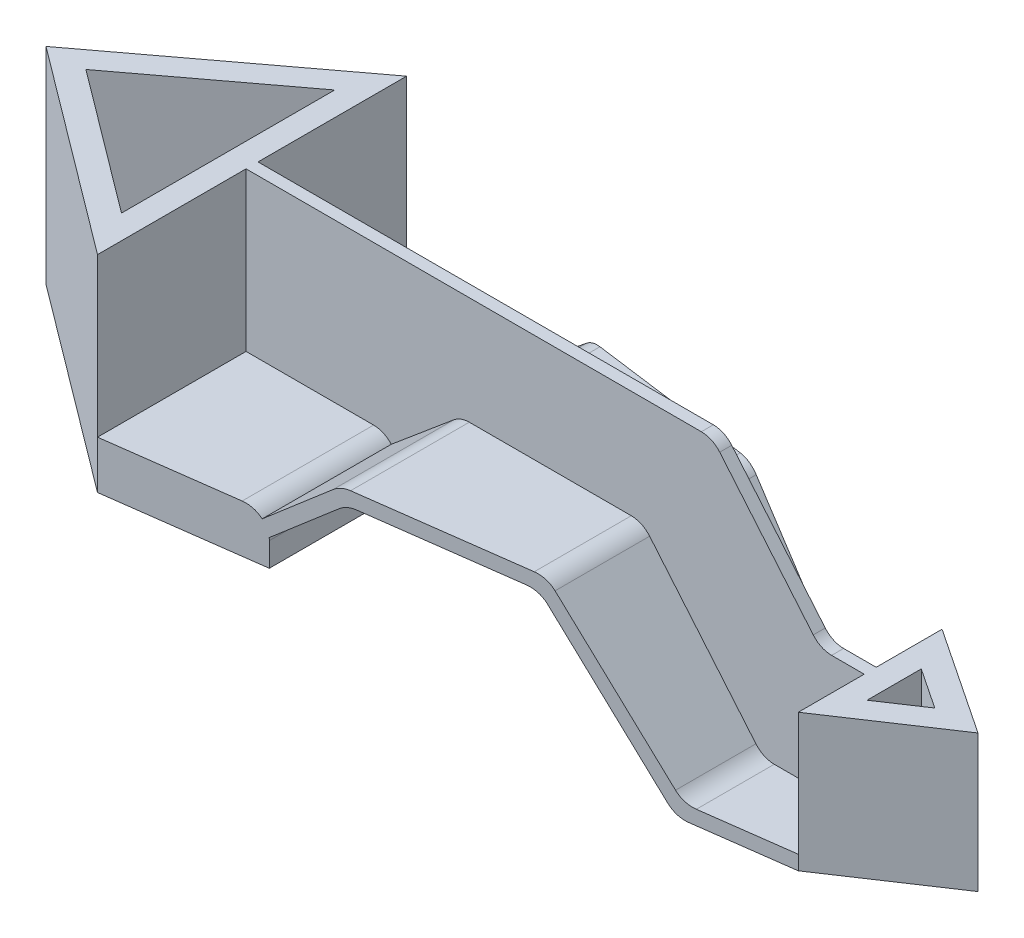
from build123d import *

# Parameters (mm, degrees)
EXTRUDE_1_DEPTH             = 86
EXTRUDE_1_2_DEPTH           = 64.5
EXTRUDE_1_2_DEPTH_BACK      = 64.5
EXTRUDE_5_DEPTH             = 57.333333333
CUT_EXTRUDE_5_DEPTH         = 328.099755426
CUT_EXTRUDE_5_DEPTH_BACK    = 328.099755426
SKETCH_13_OUTSIDE_W         = 475.92
SKETCH_13_OUTSIDE_H         = 215.92
RIB_START                   = -2.5
RIB_2_DEPTH                 = 5
FILLET_1_R                  = 10
CUT_EXTRUDE_3_DEPTH         = 322.504665596
CUT_EXTRUDE_3_DEPTH_BACK    = 322.504665596
SKETCH_10_R                 = 5
CUT_EXTRUDE_4_DEPTH         = 322.504665596
CUT_EXTRUDE_4_DEPTH_BACK    = 322.504665596
SKETCH_11_R                 = 5
EXTRUDE_6_REACH             = 323.505
EXTRUDE_6_DIRECTION_2_REACH = 323.505


# Read off the part's stored shape, not the designer's step: 보강대2
with BuildPart() as part:
    # 스케치1 → Extrude 1 (new body)
    with BuildSketch(Plane(origin=(0, 0, 0), x_dir=(1, 0, 0), z_dir=(0, 1, 0))):
        Polygon((0, 64.5), (0, -64.5), (-86, 0), align=None)
        Polygon((-10, 44.5), (-69.333333333, 0), (-10, -44.5), align=None, mode=Mode.SUBTRACT)
    extrude(amount=EXTRUDE_1_DEPTH)


with BuildPart() as body_2:
    # 스케치3 → Extrude 1 2 (new, two sides: drawn at the far end of the back side and taken through both)
    with BuildSketch(Plane.XY.offset(-EXTRUDE_1_2_DEPTH_BACK)):
        Polygon((0, 0), (50, 0), (91.711375741, 35), (162.654022129, 35), (213, -25), (258, -25), (258, -19), (215.797845949, -19), (165.451868078, 41), (89.527554335, 41), (47.816178594, 6), (0, 6), align=None)
    extrude(amount=EXTRUDE_1_2_DEPTH + EXTRUDE_1_2_DEPTH_BACK)

    # 스케치13 outside → 컷-돌출5 (cut, two sides: drawn at the far end of the back side and taken through both)
    with BuildSketch(Plane(origin=(0, -19, 0), x_dir=(1, 0, 0), z_dir=(0, 1, 0)).offset(-CUT_EXTRUDE_5_DEPTH_BACK)):
        with Locations((108.5, 0)):
            Rectangle(SKETCH_13_OUTSIDE_W, SKETCH_13_OUTSIDE_H)
        Polygon((0, 64.5), (258, 30), (258, -30), (0, -64.5), align=None, mode=Mode.SUBTRACT)
    extrude(amount=CUT_EXTRUDE_5_DEPTH + CUT_EXTRUDE_5_DEPTH_BACK, mode=Mode.SUBTRACT)


with BuildPart() as body_3:
    # 스케치12 → 보스-돌출5 (new body)
    with BuildSketch(Plane.XZ.offset(25)):
        Polygon((258, 30), (258, -30), (303, 0), align=None)
        Polygon((268, 11.314829082), (284.972243623, 0), (268, -11.314829082), align=None, mode=Mode.SUBTRACT)
    extrude(amount=-EXTRUDE_5_DEPTH)


with BuildPart() as part_1:
    add(part.part)

    # Combine 1: union body 3, body 2
    add(body_3.part)
    add(body_2.part)

    # 보강대2 outline → 보강대2 (add)
    with BuildSketch(Plane.XY.offset(RIB_START)):
        Polygon((239.734972401, 32.333333333), (194.703292194, 86), (0, 86), (0, 6), (47.816178594, 6), (89.527554335, 41), (165.451868078, 41), (215.797845949, -19), (258, -19), (258, 32.333333333), align=None)
    extrude(amount=RIB_2_DEPTH)

    # 필렛1
    fillet_1_edges = [part_1.edges().sort_by_distance(p)[0] for p in [
        (194.703292194, 86, 0),
        (213, -25, 0),
        (215.797845949, -19, 19.071655649),
        (165.451868078, 41, 22.437811146),
        (89.527554335, 41, 27.514146076),
        (47.816178594, 6, 30.302988059),
        (50, 0, 0),
        (91.711375741, 35, 0),
        (162.654022129, 35, 0),
        (47.816178594, 6, -30.302988059),
        (89.527554335, 41, -27.514146076),
        (165.451868078, 41, -22.437811146),
        (215.797845949, -19, -19.071655649),
        (239.734972401, 32.333333333, 0),
    ]]
    fillet(fillet_1_edges, radius=FILLET_1_R)

    # 스케치10 → 컷-돌출3 (cut, two sides: drawn at the far end of the back side and taken through both)
    with BuildSketch(Plane.XY.offset(-CUT_EXTRUDE_3_DEPTH_BACK)):
        with Locations((158, -20)):
            Circle(SKETCH_10_R)
    extrude(amount=CUT_EXTRUDE_3_DEPTH + CUT_EXTRUDE_3_DEPTH_BACK, mode=Mode.SUBTRACT)

    # 스케치11 → 컷-돌출4 (cut, two sides: drawn at the far end of the back side and taken through both)
    with BuildSketch(Plane.XY.offset(-CUT_EXTRUDE_4_DEPTH_BACK)):
        with Locations(Location((53.25, 10, 0), (0, 0, 44.917604926))):
            Circle(SKETCH_11_R)
    extrude(amount=CUT_EXTRUDE_4_DEPTH + CUT_EXTRUDE_4_DEPTH_BACK, mode=Mode.SUBTRACT)

    # 보스-돌출6: up to this plane
    extrude_6_end = Plane(origin=(258, -25, 30), z_dir=(0.13254117731278448, 0, 0.9911774999043013))
    # 스케치8 → 보스-돌출6 (add, up to the surface)
    with BuildSketch(Plane.XY, mode=Mode.PRIVATE) as extrude_6_sk1:
        with BuildLine():
            Line((63.25, 0), (0, 0))
            Line((0, 0), (0, 20))
            Line((0, 20), (53.25, 20))
            ThreePointArc((53.25, 20), (60.321067812, 17.071067812), (63.25, 10))
            Line((63.25, 10), (63.25, 0))
        make_face()
    extrude_6_tool1 = split(extrude(extrude_6_sk1.sketch, amount=EXTRUDE_6_REACH, mode=Mode.PRIVATE), bisect_by=extrude_6_end, keep=Keep.BOTH, mode=Mode.PRIVATE)
    add(extrude_6_tool1.solids().sort_by_distance((31.117784, 9.865974, 0))[0])

    # 보스-돌출6 direction 2: up to this plane
    extrude_6_direction_2_end = Plane(origin=(0, -25, -64.5), z_dir=(0.13254117731278448, 0, -0.9911774999043013))
    # 스케치8 → 보스-돌출6 direction 2 (add, up to the surface)
    with BuildSketch(Plane.XY, mode=Mode.PRIVATE) as extrude_6_direction_2_sk1:
        with BuildLine():
            Line((63.25, 0), (0, 0))
            Line((0, 0), (0, 20))
            Line((0, 20), (53.25, 20))
            ThreePointArc((53.25, 20), (60.321067812, 17.071067812), (63.25, 10))
            Line((63.25, 10), (63.25, 0))
        make_face()
    extrude_6_direction_2_tool1 = split(extrude(extrude_6_direction_2_sk1.sketch, amount=-EXTRUDE_6_DIRECTION_2_REACH, mode=Mode.PRIVATE), bisect_by=extrude_6_direction_2_end, keep=Keep.BOTH, mode=Mode.PRIVATE)
    add(extrude_6_direction_2_tool1.solids().sort_by_distance((31.117784, 9.865974, 0))[0])


solid = part_1.part
